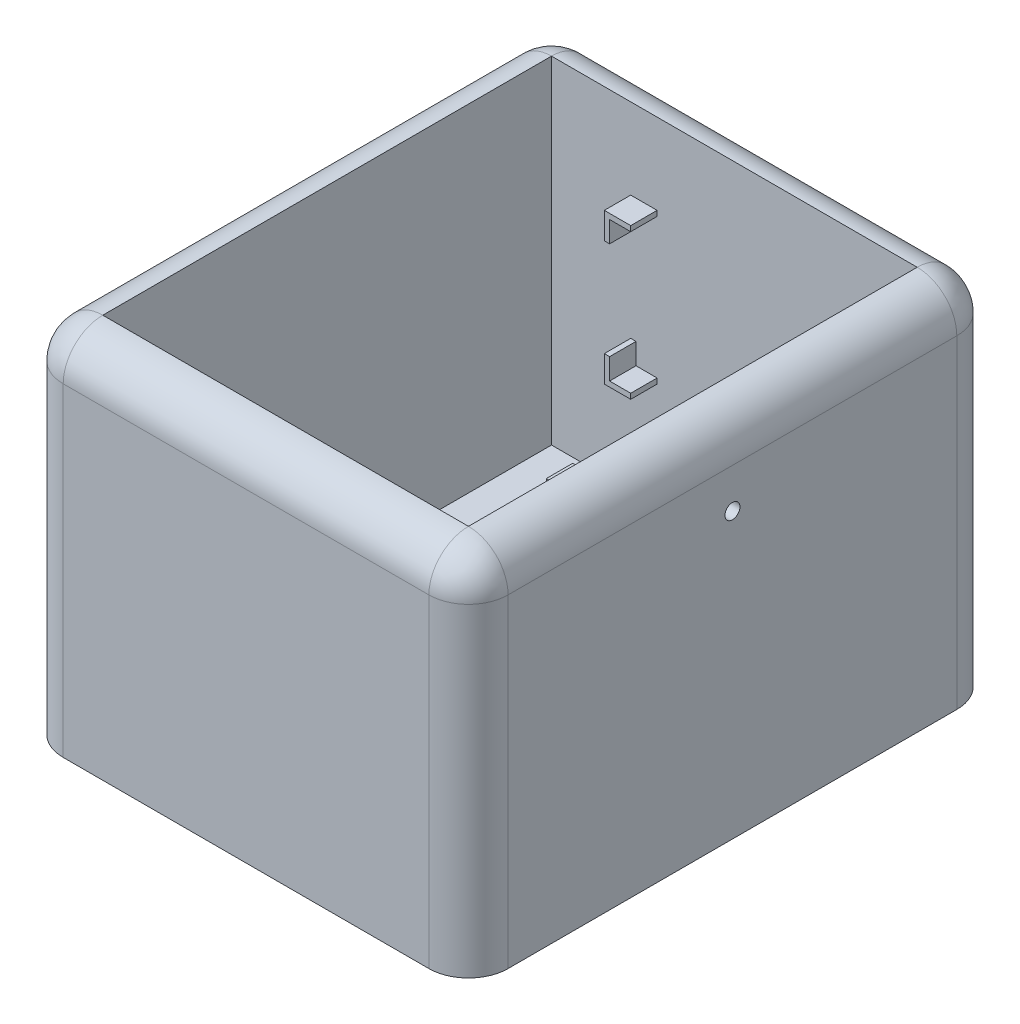
from build123d import *

# Parameters (mm, degrees)
SKETCH1_W               = 84.27
SKETCH1_H               = 100
BOSS_EXTRUDE1_DEPTH     = 68.8
SKETCH2_W               = 69.27
SKETCH2_H               = 85
CUT_EXTRUDE1_DEPTH      = 63.8
SKETCH6_W               = 5
SKETCH6_H               = 5
BOSS_EXTRUDE2_DEPTH     = 5
BOSS_EXTRUDE3_DEPTH     = 5
FILLET1_R               = 7.5
FILLET8_R               = 7.5
ADVANCEDHOLE2_OUTLINE_R = 1.5494
ADVANCEDHOLE2_DEPTH     = 10
HOLE1_START             = 34.635
HOLE1_OUTLINE_R         = 1.4224
HOLE1_DEPTH             = 7.5


# Read off the part's stored shape, not the designer's step: AdvancedHole2, Hole1
# Some blends are built 0.0001 mm under size
with BuildPart() as part:
    # Sketch1 → Boss-Extrude1 (new body)
    with BuildSketch(Plane(origin=(0, 0, 0), x_dir=(1, 0, 0), z_dir=(0, 1, 0))):
        Rectangle(SKETCH1_W, SKETCH1_H)
    extrude(amount=BOSS_EXTRUDE1_DEPTH)

    # Sketch2 → Cut-Extrude1 (cut)
    with BuildSketch(Plane(origin=(0, 68.8, 0), x_dir=(1, 0, 0), z_dir=(0, 1, 0))):
        Rectangle(SKETCH2_W, SKETCH2_H)
    extrude(amount=-CUT_EXTRUDE1_DEPTH, mode=Mode.SUBTRACT)

    # Sketch6 → Boss-Extrude2 (add)
    with BuildSketch(Plane(origin=(0, 5, 0), x_dir=(1, 0, 0), z_dir=(0, 1, 0))):
        with Locations((-22.135, 34.03)):
            Rectangle(SKETCH6_W, SKETCH6_H)
        with Locations((-22.135, -30)):
            Rectangle(SKETCH6_W, SKETCH6_H)
        with Locations((27.135, 34.03)):
            Rectangle(SKETCH6_W, SKETCH6_H)
        with Locations((27.135, -30)):
            Rectangle(SKETCH6_W, SKETCH6_H)
    extrude(amount=BOSS_EXTRUDE2_DEPTH)

    # Sketch7 → Boss-Extrude3 (add)
    with BuildSketch(Plane.XY.offset(-42.5)):
        Polygon((-19.635, 30), (-19.635, 25), (-14.635, 25), (-14.635, 26), (-18.635, 26), (-18.635, 30), align=None)
        Polygon((-19.635, 53.5), (-19.635, 48.5), (-18.635, 48.5), (-18.635, 52.5), (-14.635, 52.5), (-14.635, 53.5), align=None)
        Polygon((22.365, 53.5), (27.365, 53.5), (27.365, 48.5), (26.365, 48.5), (26.365, 52.5), (22.365, 52.5), align=None)
        Polygon((27.365, 30), (27.365, 25), (22.365, 25), (22.365, 26), (26.365, 26), (26.365, 30), align=None)
    extrude(amount=BOSS_EXTRUDE3_DEPTH)

    # Fillet1
    fillet1_edges = [part.edges().sort_by_distance(p)[0] for p in [
        (-42.135, 68.8, 0),
        (0, 68.8, 50),
        (42.135, 68.8, 0),
        (0, 68.8, -50),
    ]]
    fillet(fillet1_edges, radius=FILLET1_R - 0.0001)  # a hair under: the kernel refuses the full size

    # Fillet8
    # the kernel refuses this fillet: 7.5 mm, written as the material it takes off along each edge
    with BuildSketch(Plane(origin=(-34.635, 68.8, 42.5), x_dir=(-1, 0, 0), z_dir=(0, 0, -1))) as fillet8_piece_1:
        with BuildLine():
            CenterArc((0.0001, -7.4999), 7.4999, 0, 90)
            Line((7.5, -7.4999), (7.5, 0))
            Line((7.5, 0), (0.0001, 0))
        make_face()
    revolve(axis=Axis((-34.635, 68.8, 42.5), (0, 1, 0)), revolution_arc=90, mode=Mode.SUBTRACT)
    with BuildSketch(Plane(origin=(-34.635, 68.8, -42.5), x_dir=(0, 0, -1), z_dir=(1, 0, 0))) as fillet8_piece_2:
        with BuildLine():
            CenterArc((0.0001, -7.4999), 7.4999, 0, 90)
            Line((7.5, -7.4999), (7.5, 0))
            Line((7.5, 0), (0.0001, 0))
        make_face()
    revolve(axis=Axis((-34.635, 68.8, -42.5), (0, 1, 0)), revolution_arc=90, mode=Mode.SUBTRACT)
    with BuildSketch(Plane(origin=(34.635, 68.8, 42.5), x_dir=(0, 0, 1), z_dir=(-1, 0, 0))) as fillet8_piece_3:
        with BuildLine():
            CenterArc((0.0001, -7.4999), 7.4999, 0, 90)
            Line((7.5, -7.4999), (7.5, 0))
            Line((7.5, 0), (0.0001, 0))
        make_face()
    revolve(axis=Axis((34.635, 68.8, 42.5), (0, 1, 0)), revolution_arc=90, mode=Mode.SUBTRACT)
    with BuildSketch(Plane(origin=(34.635, 68.8, -42.5), x_dir=(1, 0, 0), z_dir=(0, 0, 1))) as fillet8_piece_4:
        with BuildLine():
            CenterArc((0.0001, -7.4999), 7.4999, 0, 90)
            Line((7.5, -7.4999), (7.5, 0))
            Line((7.5, 0), (0.0001, 0))
        make_face()
    revolve(axis=Axis((34.635, 68.8, -42.5), (0, 1, 0)), revolution_arc=90, mode=Mode.SUBTRACT)
    with BuildSketch(Plane(origin=(42.135, -18.75, -50), x_dir=(-1, 0, 0), z_dir=(0, 1, 0)), Plane(origin=(42.135, -18.75, 50), x_dir=(0, 0, -1), z_dir=(0, 1, 0))) as fillet8_piece_5:
        with BuildLine():
            CenterArc((FILLET8_R, FILLET8_R), FILLET8_R, 180, 90)
            Line((0, FILLET8_R), (0, 0))
            Line((0, 0), (FILLET8_R, 0))
        make_face()
    extrude(amount=87.55, mode=Mode.SUBTRACT)
    with BuildSketch(Plane(origin=(-42.135, -18.75, 50), x_dir=(0, 0, -1), z_dir=(0, 1, 0)), Plane(origin=(-42.135, -18.75, -50), x_dir=(1, 0, 0), z_dir=(0, 1, 0))) as fillet8_piece_6:
        with BuildLine():
            CenterArc((FILLET8_R, -FILLET8_R), FILLET8_R, 90, 90)
            Line((0, -FILLET8_R), (0, 0))
            Line((0, 0), (FILLET8_R, 0))
        make_face()
    extrude(amount=87.55, mode=Mode.SUBTRACT)

    # AdvancedHole2 outline → AdvancedHole2 (cut)
    with BuildSketch(Plane(origin=(0, 0, 0), x_dir=(1, 0, 0), z_dir=(0, 1, 0))):
        with Locations((-22.135, -30)):
            Circle(ADVANCEDHOLE2_OUTLINE_R)
        with Locations((27.135, -30)):
            Circle(ADVANCEDHOLE2_OUTLINE_R)
        with Locations((27.135, 34.03)):
            Circle(ADVANCEDHOLE2_OUTLINE_R)
        with Locations((-22.135, 34.03)):
            Circle(ADVANCEDHOLE2_OUTLINE_R)
    extrude(amount=ADVANCEDHOLE2_DEPTH, mode=Mode.SUBTRACT)

    # Hole1 outline → Hole1 (cut)
    with BuildSketch(Plane.YZ.offset(HOLE1_START)):
        with Locations((53.8, 0)):
            Circle(HOLE1_OUTLINE_R)
    extrude(amount=HOLE1_DEPTH, mode=Mode.SUBTRACT)


solid = part.part
